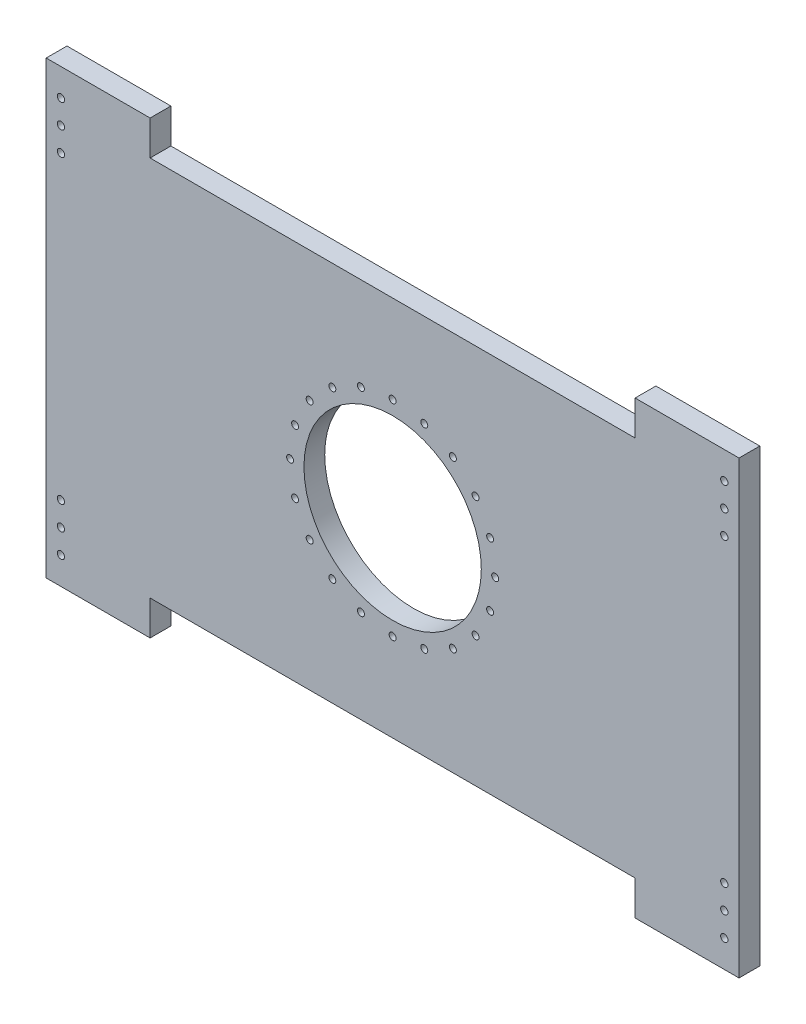
from build123d import *

# Parameters (mm, degrees)
BOSS_EXTRU_1_DEPTH           = 60
ESQUISSE2_R                  = 256
ENL_V_MAT_EXTRU_1_DEPTH      = 1564.201842374
ESQUISSE5_R                  = 10
ENL_V_MAT_EXTRU_3_DEPTH      = 1564.201842374
R_P_TITION_CIRCULAIRE1_COUNT = 20
ESQUISSE6_R                  = 10.5
ENL_V_MAT_EXTRU_4_DEPTH      = 1564.201842374


with BuildPart() as part:
    # Esquisse1 → Boss.-Extru.1 (new body)
    with BuildSketch(Plane.XY):
        Polygon((-1000, 1200), (-700, 1200), (-700, 1100), (700, 1100), (700, 1200), (1000, 1200), (1000, -100), (700, -100), (700, 0), (-700, 0), (-700, -100), (-1000, -100), align=None)
    extrude(amount=BOSS_EXTRU_1_DEPTH)

    # Esquisse2 → Enlèv. mat.-Extru.1 (cut, through all)
    with BuildSketch(Plane.XY.offset(60)):
        with Locations((0, 550)):
            Circle(ESQUISSE2_R)
    extrude(amount=-ENL_V_MAT_EXTRU_1_DEPTH, mode=Mode.SUBTRACT)

    # Esquisse5 → Enlèv. mat.-Extru.3 (cut, through all)
    with BuildSketch(Plane.XY):
        with Locations((0, 846)):
            Circle(ESQUISSE5_R)
    enl_v_mat_extru_3 = extrude(amount=ENL_V_MAT_EXTRU_3_DEPTH, mode=Mode.SUBTRACT)

    # Répétition circulaire1: Enlèv. mat.-Extru.3 ×20 about axis
    r_p_tition_circulaire1_axis = Axis((0, 550, 0), (0, 0, -1))
    for i in range(1, R_P_TITION_CIRCULAIRE1_COUNT):
        add(enl_v_mat_extru_3.rotate(r_p_tition_circulaire1_axis, i * 360 / R_P_TITION_CIRCULAIRE1_COUNT), mode=Mode.SUBTRACT)

    # Esquisse6 → Enlèv. mat.-Extru.4 (cut, through all)
    with BuildSketch(Plane(origin=(0, 0, 0), x_dir=(-1, 0, 0), z_dir=(0, 0, -1))):
        with Locations((-957.5, -21.25)):
            Circle(ESQUISSE6_R)
        with Locations((-957.5, 1121.25)):
            Circle(ESQUISSE6_R)
        with Locations((957.5, 1121.25)):
            Circle(ESQUISSE6_R)
        with Locations((957.5, -21.25)):
            Circle(ESQUISSE6_R)
        with Locations((-957.5, 47.5)):
            Circle(ESQUISSE6_R)
        with Locations((-957.5, 116.25)):
            Circle(ESQUISSE6_R)
        with Locations((-957.5, 983.75)):
            Circle(ESQUISSE6_R)
        with Locations((-957.5, 1052.5)):
            Circle(ESQUISSE6_R)
        with Locations((957.5, 47.5)):
            Circle(ESQUISSE6_R)
        with Locations((957.5, 116.25)):
            Circle(ESQUISSE6_R)
        with Locations((957.5, 1052.5)):
            Circle(ESQUISSE6_R)
        with Locations((957.5, 983.75)):
            Circle(ESQUISSE6_R)
    extrude(amount=-ENL_V_MAT_EXTRU_4_DEPTH, mode=Mode.SUBTRACT)


solid = part.part
